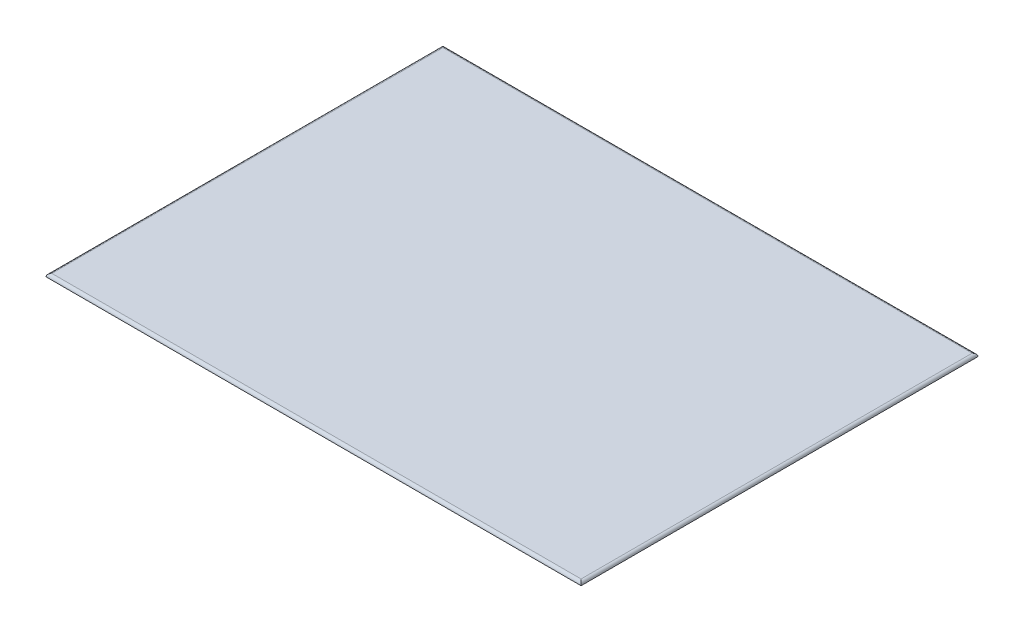
from build123d import *

# Parameters (mm, degrees)
SKETCH1_W           = 182
SKETCH1_H           = 135
BOSS_EXTRUDE1_DEPTH = 9
FILLET4_R           = 1
FILLET5_R           = 55


with BuildPart() as part:
    # Sketch1 → Boss-Extrude1 (new body)
    with BuildSketch(Plane(origin=(0, 0, 0), x_dir=(1, 0, 0), z_dir=(0, 1, 0))):
        Rectangle(SKETCH1_W, SKETCH1_H)
    extrude(amount=BOSS_EXTRUDE1_DEPTH)

    # Fillet4
    fillet4_edges = [part.edges().sort_by_distance(p)[0] for p in [
        (-91, 9, 0),
        (0, 9, 67.5),
        (91, 9, 0),
        (0, 9, -67.5),
    ]]
    fillet(fillet4_edges, radius=FILLET4_R)

    # Fillet5
    # the kernel refuses this fillet: 55 mm, written as the material it takes off along each edge
    with BuildSketch(Plane(origin=(162.414284285, 0, -67.5), x_dir=(0, 0, 1), z_dir=(-1, 0, 0))) as fillet5_piece_1:
        with BuildLine():
            CenterArc((28.565713714, 55), FILLET5_R, 238.709554786, 31.290445214)
            Line((0, 8), (0, 0))
            Line((0, 0), (28.565713714, 0))
        make_face()
    extrude(amount=324.828568571, mode=Mode.SUBTRACT)
    with BuildSketch(Plane(origin=(-91, 0, -138.914284285), x_dir=(0, 1, 0), z_dir=(0, 0, 1))) as fillet5_piece_2:
        with BuildLine():
            CenterArc((55, -28.565713714), FILLET5_R, 148.709554786, 31.290445214)
            Line((0, -28.565713714), (0, 0))
            Line((0, 0), (8, 0))
        make_face()
    extrude(amount=277.828568571, mode=Mode.SUBTRACT)
    with BuildSketch(Plane(origin=(-162.414284285, 0, 67.5), x_dir=(0, 1, 0), z_dir=(1, 0, 0))) as fillet5_piece_3:
        with BuildLine():
            CenterArc((55, -28.565713714), FILLET5_R, 148.709554786, 31.290445214)
            Line((0, -28.565713714), (0, 0))
            Line((0, 0), (8, 0))
        make_face()
    extrude(amount=324.828568571, mode=Mode.SUBTRACT)
    with BuildSketch(Plane(origin=(91, 0, 138.914284285), x_dir=(-1, 0, 0), z_dir=(0, 0, -1))) as fillet5_piece_4:
        with BuildLine():
            CenterArc((28.565713714, 55), FILLET5_R, 238.709554786, 31.290445214)
            Line((0, 8), (0, 0))
            Line((0, 0), (28.565713714, 0))
        make_face()
    extrude(amount=277.828568571, mode=Mode.SUBTRACT)


solid = part.part
